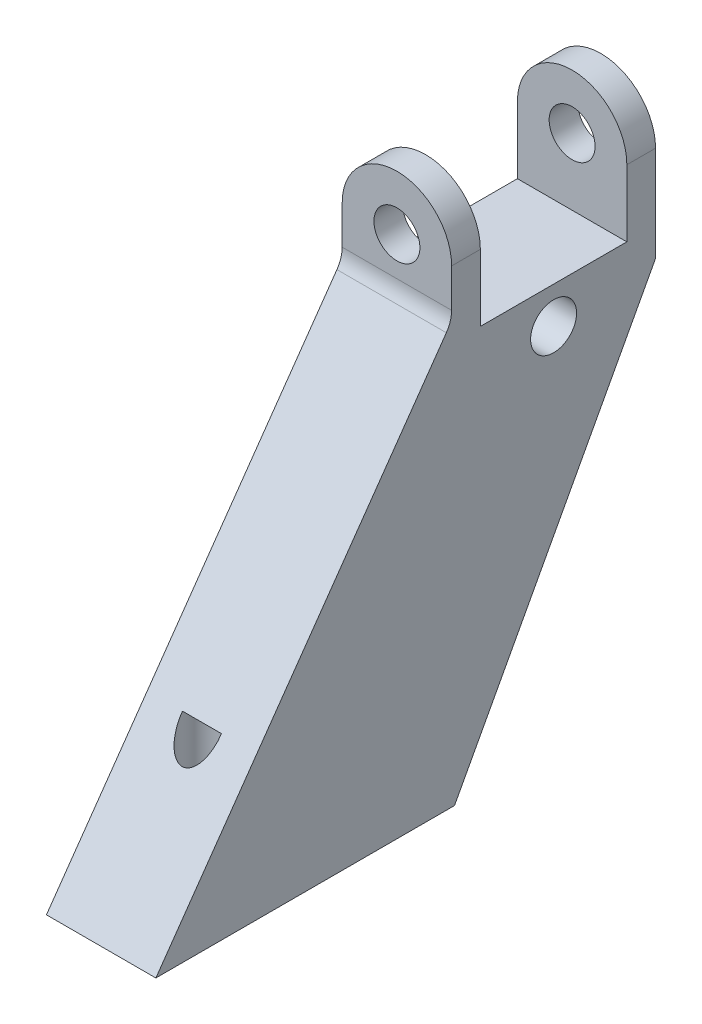
from build123d import *
from build123d.topology import SkipClean

# Parameters (mm, degrees)
SKETCH6_W           = 19.05
SKETCH6_H           = 133.908026583
BOSS_EXTRUDE5_DEPTH = 101.6
SKETCH10_W          = 25.504488372
SKETCH10_H          = 23.275439273
CUT_EXTRUDE6_DEPTH  = 172.247967102
SKETCH12_R          = 4
CUT_EXTRUDE7_DEPTH  = 118.754114563
SKETCH14_R          = 3.4
CUT_EXTRUDE8_DEPTH  = 25
THREAD1_PITCH       = 1.25
THREAD2_PITCH       = 1.25
SKETCH19_R          = 4
CUT_EXTRUDE9_DEPTH  = 130.91098634


with BuildPart() as part:
    # Sketch6 → Boss-Extrude5 (new body)
    with BuildSketch(Plane(origin=(0, 3.43144364, 0), x_dir=(-1, 0, 0), z_dir=(0, 1, 0))):
        with Locations((-3.989422479, 66.954013292)):
            Rectangle(SKETCH6_W, SKETCH6_H)
    extrude(amount=BOSS_EXTRUDE5_DEPTH)

    # Sketch10 → Cut-Extrude6 (cut, through all)
    with BuildSketch(Plane(origin=(13.514422479, 0, 0), x_dir=(0, 0, -1), z_dir=(1, 0, 0))):
        with BuildLine():
            Line((-87.000000104, 3.43144364), (-167.598373303, 3.43144364))
            Line((-167.598373303, 3.43144364), (-168.555842831, 132.882439452))
            Line((-168.555842831, 132.882439452), (-35.504488372, 117.022814853))
            Line((-35.504488372, 117.022814853), (-35.504488372, 78.357297482))
            ThreePointArc((-35.504488372, 78.357297482), (-35.740698196, 76.826253156), (-36.4273611, 75.437589819))
            Line((-36.4273611, 75.437589819), (-87.000000104, 3.43144364))
        make_face()
        Polygon((-35.000000104, 3.43144364), (7.433427186, 3.43144364), (7.433427186, 68.43144364), (0, 68.43144364), align=None)
        with Locations((-17.752244186, 85.069163277)):
            Rectangle(SKETCH10_W, SKETCH10_H)
    extrude(amount=-CUT_EXTRUDE6_DEPTH, mode=Mode.SUBTRACT)

    # Sketch12 → Cut-Extrude7 (cut, through all)
    with BuildSketch(Plane.XY.offset(35.504488372)):
        with Locations((3.989422479, 85.052808464)):
            Circle(SKETCH12_R)
        with BuildLine():
            Line((13.514422479, 85.052808464), (39.943289933, 85.052808464))
            Line((39.943289933, 85.052808464), (39.943289933, 114.808056181))
            Line((39.943289933, 114.808056181), (-16.126426649, 114.808056181))
            Line((-16.126426649, 114.808056181), (-16.126426649, 85.052808464))
            Line((-16.126426649, 85.052808464), (-5.535577521, 85.052808464))
            ThreePointArc((-5.535577521, 85.052808464), (3.989422479, 94.577808464), (13.514422479, 85.052808464))
        make_face()
    extrude(amount=-CUT_EXTRUDE7_DEPTH, mode=Mode.SUBTRACT)

    # Sketch14 → Cut-Extrude8 (cut)
    with BuildSketch(Plane.XZ.offset(-3.43144364)):
        with Locations(Location((3.989422479, 69.500000104, 0), (0, 0, 270))):
            Circle(SKETCH14_R)
        with Locations(Location((3.989422479, 42.500000104, 0), (0, 0, 270))):
            Circle(SKETCH14_R)
    extrude(amount=-CUT_EXTRUDE8_DEPTH, mode=Mode.SUBTRACT)

    # Thread1: the profile of Thread Profile1 profile screwed along a right-hand helix of 12 turns, 8 arcs to a turn; built about Z, then put on its axis
    with SkipClean():  # the faces are left unmerged after this step: merging them gives an invalid solid
        thread1_z = Axis((0, 0, 0), (0, 0, 1))
        thread1_corners = [(3.3997, 0, -0.000173206), (4.076582344, 0, 0.390624998), (4.076582344, 0, 0.546874998), (3.3997, 0, 0.937673201)]
        with BuildLine(mode=Mode.PRIVATE) as thread1_profile:
            Line(thread1_corners[0], thread1_corners[1])
            Line(thread1_corners[1], thread1_corners[2])
            Line(thread1_corners[2], thread1_corners[3])
            Line(thread1_corners[3], thread1_corners[0])
        thread1_cap = Face(thread1_profile.wire())
        thread1_turn_angles = [0, 22.5, 45, 67.5, 90, 112.5, 135, 157.5, 180, 202.5, 225, 247.5, 270, 292.5, 315, 337.5, 360]
        thread1_turn_weights = [1, 0.9238795325112867, 1, 0.9238795325112867, 1, 0.9238795325112867, 1, 0.9238795325112867, 1, 0.9238795325112867, 1, 0.9238795325112867, 1, 0.9238795325112867, 1, 0.9238795325112867, 1]
        thread1_turn_rails = [Edge.make_bspline([Vector(p[0], p[1], 0).rotate(thread1_z, thread1_turn_angles[k]) / thread1_turn_weights[k] + Vector(0, 0, p[2] + THREAD1_PITCH * thread1_turn_angles[k] / 360) for k in range(17)], [0, 0, 0, 1, 1, 2, 2, 3, 3, 4, 4, 5, 5, 6, 6, 7, 7, 8, 8, 8], 2, thread1_turn_weights) for p in thread1_corners]
        thread1_turn_sides = [Face.make_surface_from_curves(thread1_turn_rails[p[0]], thread1_turn_rails[p[1]]) for p in [(0, 1), (1, 2), (2, 3), (3, 0)]]
        thread1 = Plane(origin=(3.989422479, 3.43144364, 42.500000104), x_dir=(1, 0, 0), z_dir=(0, 1, 0)) * Solid(Shell([*[p.moved(Location((0, 0, THREAD1_PITCH * i))) for i in range(12) for p in thread1_turn_sides], thread1_cap, thread1_cap.rotate(thread1_z, 4320).moved(Location((0, 0, THREAD1_PITCH * 4320 / 360)))]))
        add(thread1, mode=Mode.SUBTRACT)

    # Thread2: the profile of Thread Profile2 profile screwed along a right-hand helix of 12 turns, 8 arcs to a turn; built about Z, then put on its axis
    with SkipClean():  # the faces are left unmerged after this step: merging them gives an invalid solid
        thread2_z = Axis((0, 0, 0), (0, 0, 1))
        thread2_corners = [(3.3997, 0, -0.000173206), (4.076582344, 0, 0.390624998), (4.076582344, 0, 0.546874998), (3.3997, 0, 0.937673201)]
        with BuildLine(mode=Mode.PRIVATE) as thread2_profile:
            Line(thread2_corners[0], thread2_corners[1])
            Line(thread2_corners[1], thread2_corners[2])
            Line(thread2_corners[2], thread2_corners[3])
            Line(thread2_corners[3], thread2_corners[0])
        thread2_cap = Face(thread2_profile.wire())
        thread2_turn_angles = [0, 22.5, 45, 67.5, 90, 112.5, 135, 157.5, 180, 202.5, 225, 247.5, 270, 292.5, 315, 337.5, 360]
        thread2_turn_weights = [1, 0.9238795325112867, 1, 0.9238795325112867, 1, 0.9238795325112867, 1, 0.9238795325112867, 1, 0.9238795325112867, 1, 0.9238795325112867, 1, 0.9238795325112867, 1, 0.9238795325112867, 1]
        thread2_turn_rails = [Edge.make_bspline([Vector(p[0], p[1], 0).rotate(thread2_z, thread2_turn_angles[k]) / thread2_turn_weights[k] + Vector(0, 0, p[2] + THREAD2_PITCH * thread2_turn_angles[k] / 360) for k in range(17)], [0, 0, 0, 1, 1, 2, 2, 3, 3, 4, 4, 5, 5, 6, 6, 7, 7, 8, 8, 8], 2, thread2_turn_weights) for p in thread2_corners]
        thread2_turn_sides = [Face.make_surface_from_curves(thread2_turn_rails[p[0]], thread2_turn_rails[p[1]]) for p in [(0, 1), (1, 2), (2, 3), (3, 0)]]
        thread2 = Plane(origin=(3.989422479, 3.43144364, 69.500000104), x_dir=(1, 0, 0), z_dir=(0, 1, 0)) * Solid(Shell([*[p.moved(Location((0, 0, THREAD2_PITCH * i))) for i in range(12) for p in thread2_turn_sides], thread2_cap, thread2_cap.rotate(thread2_z, 4320).moved(Location((0, 0, THREAD2_PITCH * 4320 / 360)))]))
        add(thread2, mode=Mode.SUBTRACT)

    # Sketch19 → Cut-Extrude9 (cut, through all)
    with SkipClean():  # the faces are left unmerged after this step: merging them gives an invalid solid
        with BuildSketch(Plane(origin=(13.514422479, 0, 0), x_dir=(0, 0, -1), z_dir=(1, 0, 0))):
            with Locations(Location((-17.752244186, 67.08144364, 0), (0, 0, 90))):
                Circle(SKETCH19_R)
        extrude(amount=-CUT_EXTRUDE9_DEPTH, mode=Mode.SUBTRACT)


solid = part.part
